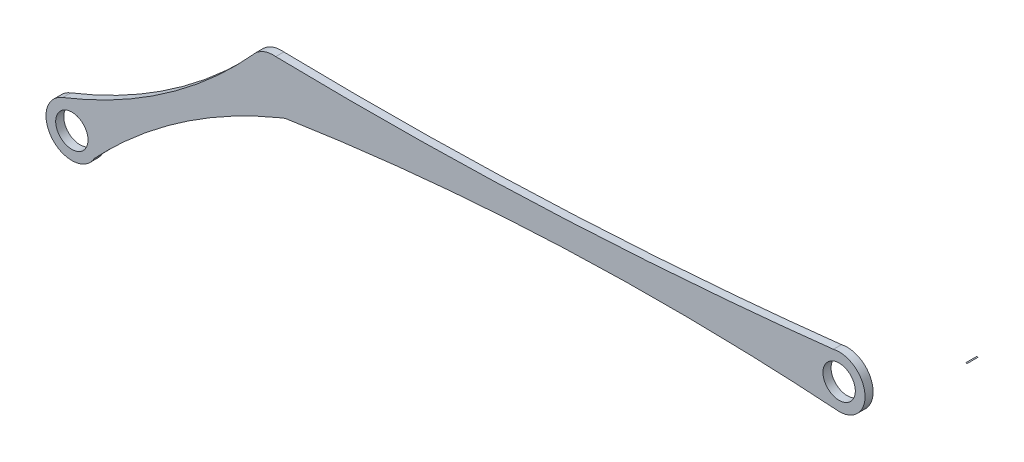
from build123d import *

# Parameters (mm, degrees)
SKETCH1_R           = 7.9375
BOSS_EXTRUDE1_DEPTH = 3.96875
CUT_EXTRUDE1_DEPTH  = 324.071313784
SCALE1_SCALE        = 0.75


with BuildPart() as part:
    # Sketch1 → Boss-Extrude1 (new body)
    with BuildSketch(Plane.XY):
        with BuildLine():
            Line((278.579111194, 25.386731605), (7.002261578, 16.605199607))
            ThreePointArc((7.002261578, 16.605199607), (3.572001438, 17.66366686), (0, 18.021218638))
            ThreePointArc((0, 18.021218638), (-5.566811259, 17.139863874), (-10.589115987, 14.582007538))
            Line((-10.589115987, 14.582007538), (-112.456168951, -61.260615837))
            ThreePointArc((-112.456168951, -61.260615837), (-117.661054869, -96.802551105), (-82.119119601, -102.007437023))
            Line((-82.119119601, -102.007437023), (2.626401935, -38.912231208))
            ThreePointArc((2.626401935, -38.912231208), (9.416461191, -35.307290789), (16.974037803, -33.898910196))
            Line((16.974037803, -33.898910196), (280.220888806, -25.386731605))
            ThreePointArc((280.220888806, -25.386731605), (304.786731605, 0.820888806), (278.579111194, 25.386731605))
        make_face()
        with Locations((-97.287644276, -81.63402643)):
            Circle(SKETCH1_R, mode=Mode.SUBTRACT)
        with Locations((279.4, 0)):
            Circle(SKETCH1_R, mode=Mode.SUBTRACT)
    extrude(amount=BOSS_EXTRUDE1_DEPTH)

    # Sketch2 → Cut-Extrude1 (cut, through all)
    with BuildSketch(Plane.XY.offset(3.96875)):
        with BuildLine():
            Line((-53.969446012, -4.744671806), (-134.329544165, -73.239132517))
            ThreePointArc((-134.329544165, -73.239132517), (-125.60525441, -106.945872422), (-93.084490484, -119.382007693))
            Line((-93.084490484, -119.382007693), (5.391196219, -67.591740386))
            Line((5.391196219, -67.591740386), (280.559963716, -25.373499644))
            ThreePointArc((280.559963716, -25.373499644), (304.773499644, 1.159963716), (278.240036284, 25.373499644))
            Line((278.240036284, 25.373499644), (46.741351585, 20.654902712))
            ThreePointArc((46.741351585, 20.654902712), (-12.131424739, 41.72701519), (-53.969446012, -4.744671806))
        make_face()
        with BuildLine():
            add(Edge.make_bspline(
                [(7.343872653, -24.024450777), (141.939870387, -3.391503831), (277.670553151, -12.58169359)],
                knots=[0, 0, 0, 0.993669622, 0.993669622, 0.993669622], degree=2))
            ThreePointArc((7.343872653, -24.024450777), (6.384059671, -24.462532684), (5.391196219, -24.819434467))
            add(Edge.make_bspline(
                [(5.391196219, -24.819434467), (-47.371168783, -46.53348503), (-86.207298162, -87.840146796)],
                knots=[0.018124898, 0.018124898, 0.018124898, 1, 1, 1], degree=2))
            ThreePointArc((-86.207298162, -87.840146796), (-106.918618869, -89.912572703), (-101.759421239, -69.747344354))
            add(Edge.make_bspline(
                [(-101.759421239, -69.747344354), (-47.637210532, -48.302448827), (-8.304397238, -4.744671806)],
                knots=[0.003611947, 0.003611947, 0.003611947, 1, 1, 1], degree=2))
            ThreePointArc((-8.304397238, -4.744671806), (-4.207074532, -1.402956863), (0.895916614, -0.019268502))
            ThreePointArc((0.895916614, -0.019268502), (1.85975658, -0.002755052), (2.822072535, -0.059395822))
            add(Edge.make_bspline(
                [(2.822072535, -0.059395822), (140.13746109, -2.856877681), (276.581108414, 12.383208398)],
                knots=[0.010068083, 0.010068083, 0.010068083, 0.989878349, 0.989878349, 0.989878349], degree=2))
            ThreePointArc((276.581108414, 12.383208398), (292.087924513, 0.553689039), (277.670553151, -12.58169359))
        make_face(mode=Mode.SUBTRACT)
    extrude(amount=-CUT_EXTRUDE1_DEPTH, mode=Mode.SUBTRACT)


with BuildPart() as cut_extrude1_piece_1:
    # of the separate pieces the step leaves, piece 1, a body of its own (cut_extrude1_pieces)
    add(part.part.solids().sort_by_distance((-101.759421239, -69.747344354, 0))[0])


with BuildPart() as cut_extrude1_piece_2:
    # of the separate pieces the step leaves, piece 2, a body of its own (cut_extrude1_pieces)
    add(part.part.solids().sort_by_distance((278.579111194, 25.386731605, 0))[0])


with BuildPart() as cut_extrude1_piece_1_1:
    # Scale1: scaled about (85.517043647, -17.972624754, 1.984374998)
    add(cut_extrude1_piece_1.part.scale(SCALE1_SCALE).moved(Location((21.379260912, -4.493156189, 0.49609375))))


solid = Compound([cut_extrude1_piece_2.part, cut_extrude1_piece_1_1.part])
